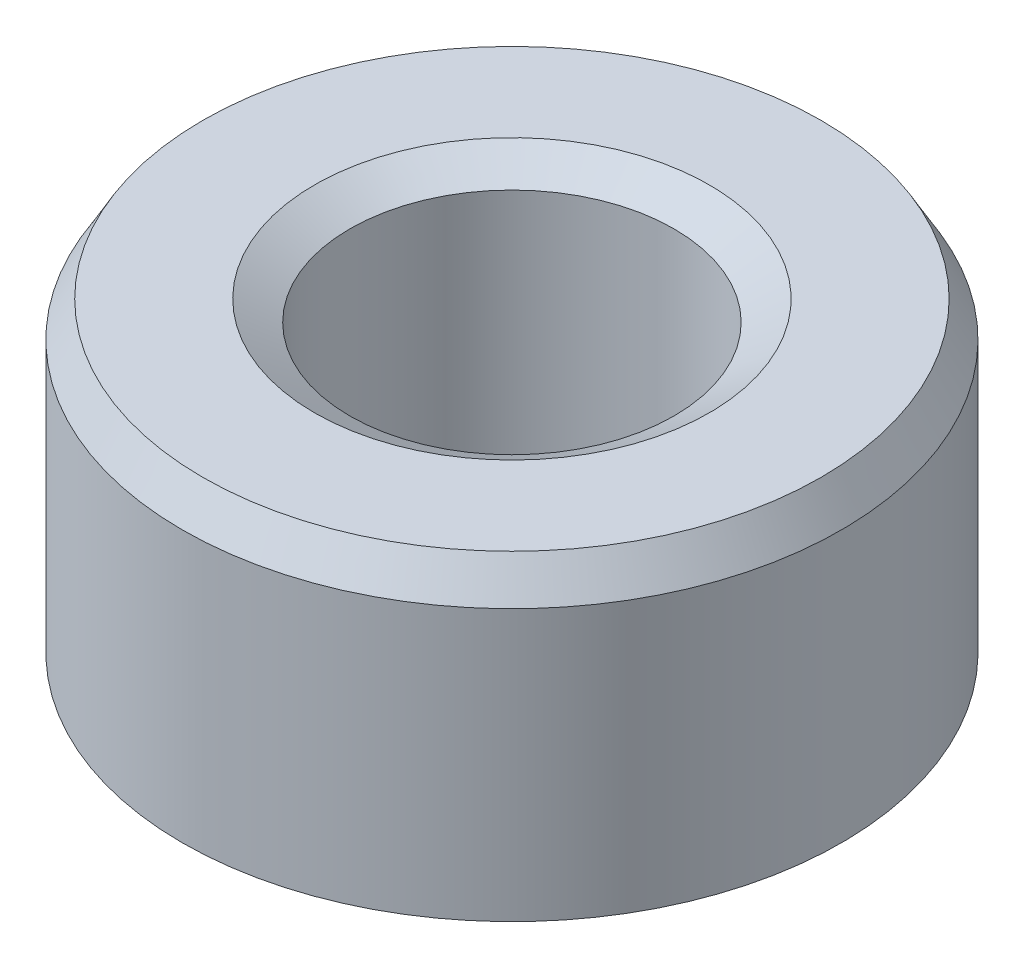
from build123d import *
from OCP.BRepFilletAPI import BRepFilletAPI_MakeChamfer

# Parameters (mm, degrees)
SKETCH1_R           = 35
BOSS_EXTRUDE1_DEPTH = 34.698527501
SKETCH2_R           = 17.216363879
CUT_EXTRUDE1_DEPTH  = 61.448224215
CHAMFER1_SIZE       = 3.751285522
CHAMFER1_SIZE2      = 2.165805706


with BuildPart() as part:
    # Sketch1 → Boss-Extrude1 (new body)
    with BuildSketch(Plane(origin=(0, 0, 0), x_dir=(1, 0, 0), z_dir=(0, 1, 0))):
        Circle(SKETCH1_R)
    extrude(amount=BOSS_EXTRUDE1_DEPTH)

    # Sketch2 → Cut-Extrude1 (cut, through all)
    with BuildSketch(Plane(origin=(0, 0, 0), x_dir=(1, 0, 0), z_dir=(0, 1, 0))):
        Circle(SKETCH2_R)
    extrude(amount=CUT_EXTRUDE1_DEPTH, mode=Mode.SUBTRACT)

    # Chamfer1: one chamfer whose edges measure the first distance from different faces: ONE call of the kernel's chamfer builder (chamfer() names one face for all edges)
    chamfer1_edges_1 = [part.edges().sort_by_distance(p)[0] for p in [
        (-17.216363879, 34.698527501, 0),
    ]]
    chamfer1_side_1 = [part.faces().sort_by_distance(p)[0] for p in [
        (-34.010050506, 34.698527501, 0),
    ]]
    chamfer1_edges_2 = [part.edges().sort_by_distance(p)[0] for p in [
        (-17.216363879, 0, 0),
    ]]
    chamfer1_side_2 = [part.faces().sort_by_distance(p)[0] for p in [
        (-17.216363879, 17.34926375, 0),
    ]]
    chamfer1_edges_3 = [part.edges().sort_by_distance(p)[0] for p in [
        (-35, 0, 0),
    ]]
    chamfer1_side_3 = [part.faces().sort_by_distance(p)[0] for p in [
        (-34.010050506, 0, 0),
    ]]
    chamfer1_edges_4 = [part.edges().sort_by_distance(p)[0] for p in [
        (-35, 34.698527501, 0),
    ]]
    chamfer1_side_4 = [part.faces().sort_by_distance(p)[0] for p in [
        (-35, 17.34926375, 0),
    ]]
    chamfer1 = BRepFilletAPI_MakeChamfer(part.part.solid().wrapped)
    for e in chamfer1_edges_1:
        chamfer1.Add(CHAMFER1_SIZE, CHAMFER1_SIZE2, e.wrapped, chamfer1_side_1[0].wrapped)  # the first distance lies on this face
    for e in chamfer1_edges_2:
        chamfer1.Add(CHAMFER1_SIZE, CHAMFER1_SIZE2, e.wrapped, chamfer1_side_2[0].wrapped)  # the first distance lies on this face
    for e in chamfer1_edges_3:
        chamfer1.Add(CHAMFER1_SIZE, CHAMFER1_SIZE2, e.wrapped, chamfer1_side_3[0].wrapped)  # the first distance lies on this face
    for e in chamfer1_edges_4:
        chamfer1.Add(CHAMFER1_SIZE, CHAMFER1_SIZE2, e.wrapped, chamfer1_side_4[0].wrapped)  # the first distance lies on this face
    add(Compound.cast(chamfer1.Shape()), mode=Mode.REPLACE)


solid = part.part
